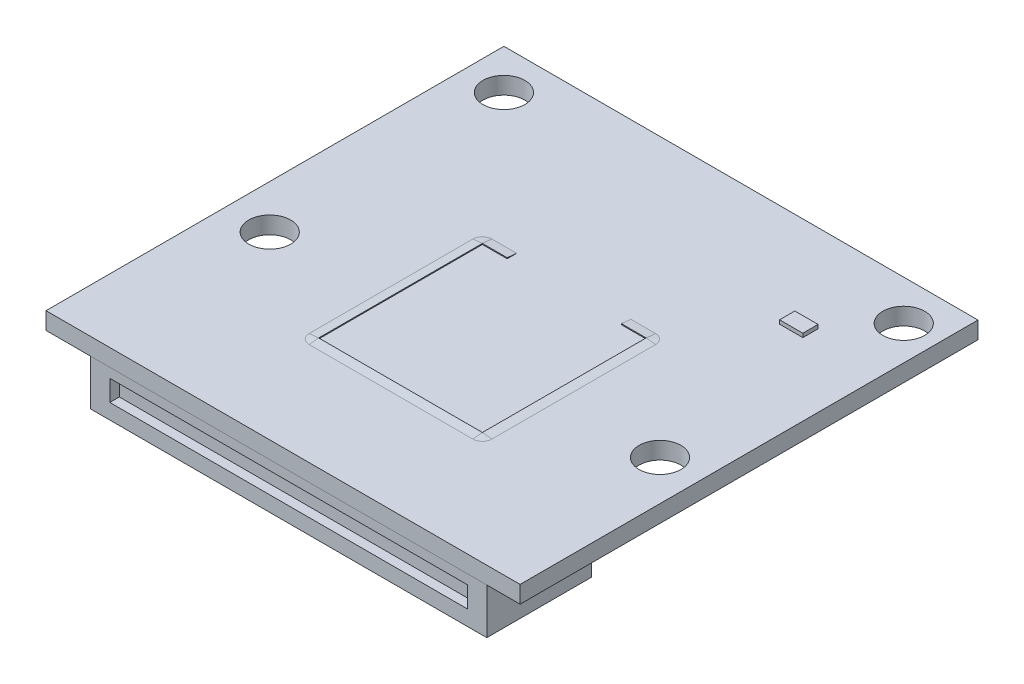
from build123d import *
from OCP.BRepFilletAPI import BRepFilletAPI_MakeChamfer

# Parameters (mm, degrees)
SKIZZE1_W               = 24.9
SKIZZE1_H               = 24.05
SKIZZE1_R               = 1.1
PCB_DEPTH               = 0.9
BOSS_EXTRUDE1_DEPTH     = 0.05
SKIZZE3_W               = 20.8
SKIZZE3_H               = 5.5
CONNECTOR_CLOSED_DEPTH  = 2.4
ESQUISSE1_W             = 1.22
ESQUISSE1_H             = 0.8
STATUS_LED_DEPTH        = 0.2
ESQUISSE3_W             = 18.8
ESQUISSE3_H             = 1.1
ENL_V_MAT_EXTRU_1_DEPTH = 0.5
FILLET1_R               = 0.5
CHAMFER1_SIZE           = 0.05
CHAMFER1_SIZE_2         = 0.5


with BuildPart() as part:
    # Skizze1 → PCB (new body)
    with BuildSketch(Plane(origin=(0, 0, 0), x_dir=(1, 0, 0), z_dir=(0, 1, 0))):
        with Locations((-0.3, 1.855)):
            Rectangle(SKIZZE1_W, SKIZZE1_H)
        with Locations(Location((-10.65, 11.78, 0), (0, 0, 270))):
            Circle(SKIZZE1_R, mode=Mode.SUBTRACT)
        with Locations(Location((10.35, 11.78, 0), (0, 0, 270))):
            Circle(SKIZZE1_R, mode=Mode.SUBTRACT)
        with Locations(Location((-10.45, -0.72, 0), (0, 0, 270))):
            Circle(SKIZZE1_R, mode=Mode.SUBTRACT)
        with Locations(Location((10.05, -0.72, 0), (0, 0, 270))):
            Circle(SKIZZE1_R, mode=Mode.SUBTRACT)
    extrude(amount=-PCB_DEPTH)

    # Sketch4 → Boss-Extrude1 (add)
    with BuildSketch(Plane(origin=(0, 0, 0), x_dir=(1, 0, 0), z_dir=(0, 1, 0))):
        Polygon((-4.3, 4.3), (-3, 4.3), (-3, 4.8), (-4.8, 4.8), (-4.8, -4.8), (4.8, -4.8), (4.8, 4.8), (3, 4.8), (3, 4.3), (4.3, 4.3), (4.3, -4.3), (-4.3, -4.3), align=None)
    extrude(amount=BOSS_EXTRUDE1_DEPTH)

    # Skizze3 → Connector_closed (add)
    with BuildSketch(Plane.XZ.offset(0.9)):
        with Locations((0, 7.42)):
            Rectangle(SKIZZE3_W, SKIZZE3_H)
    extrude(amount=CONNECTOR_CLOSED_DEPTH)

    # Esquisse1 → Status LED (add)
    with BuildSketch(Plane(origin=(0, 0, 0), x_dir=(1, 0, 0), z_dir=(0, 1, 0))):
        with Locations((7.74, 8.88)):
            Rectangle(ESQUISSE1_W, ESQUISSE1_H)
    extrude(amount=STATUS_LED_DEPTH)

    # Esquisse3 → Enlèv. mat.-Extru.1 (cut)
    with BuildSketch(Plane.XY.offset(10.17)):
        with Locations((0, -1.95)):
            Rectangle(ESQUISSE3_W, ESQUISSE3_H)
    extrude(amount=-ENL_V_MAT_EXTRU_1_DEPTH, mode=Mode.SUBTRACT)

    # Fillet1
    fillet1_edges = [part.edges().sort_by_distance(p)[0] for p in [
        (-4.8, 0.025, -4.8),
        (-4.8, 0.025, 4.8),
        (4.8, 0.025, 4.8),
        (4.8, 0.025, -4.8),
    ]]
    fillet(fillet1_edges, radius=FILLET1_R)

    # Chamfer1
    chamfer1_edges_1 = [part.edges().sort_by_distance(p)[0] for p in [
        (3.65, 0.05, -4.8),
    ]]
    chamfer1_side_1 = [part.faces().sort_by_distance(p)[0] for p in [
        (3.65, 0.049, -4.8),
    ]]
    chamfer1_edges_2 = [part.edges().sort_by_distance(p)[0] for p in [
        (4.8, 0.05, 0),
    ]]
    chamfer1_side_2 = [part.faces().sort_by_distance(p)[0] for p in [
        (4.8, 0.049, 0),
    ]]
    chamfer1_edges_3 = [part.edges().sort_by_distance(p)[0] for p in [
        (0, 0.05, 4.8),
    ]]
    chamfer1_side_3 = [part.faces().sort_by_distance(p)[0] for p in [
        (0, 0.049, 4.8),
    ]]
    chamfer1_edges_4 = [part.edges().sort_by_distance(p)[0] for p in [
        (-4.8, 0.05, 0),
    ]]
    chamfer1_side_4 = [part.faces().sort_by_distance(p)[0] for p in [
        (-4.8, 0.049, 0),
    ]]
    chamfer1_edges_5 = [part.edges().sort_by_distance(p)[0] for p in [
        (-3.65, 0.05, -4.8),
    ]]
    chamfer1_side_5 = [part.faces().sort_by_distance(p)[0] for p in [
        (-3.65, 0.049, -4.8),
    ]]
    chamfer1_edges_6 = [part.edges().sort_by_distance(p)[0] for p in [
        (4.653553391, 0.05, -4.653553391),
    ]]
    chamfer1_side_6 = [part.faces().sort_by_distance(p)[0] for p in [
        (4.653553391, 0.049, -4.653553391),
    ]]
    chamfer1_edges_7 = [part.edges().sort_by_distance(p)[0] for p in [
        (4.653553391, 0.05, 4.653553391),
    ]]
    chamfer1_side_7 = [part.faces().sort_by_distance(p)[0] for p in [
        (4.653553391, 0.049, 4.653553391),
    ]]
    chamfer1_edges_8 = [part.edges().sort_by_distance(p)[0] for p in [
        (-4.653553391, 0.05, 4.653553391),
    ]]
    chamfer1_side_8 = [part.faces().sort_by_distance(p)[0] for p in [
        (-4.653553391, 0.049, 4.653553391),
    ]]
    chamfer1_edges_9 = [part.edges().sort_by_distance(p)[0] for p in [
        (-4.653553391, 0.05, -4.653553391),
    ]]
    chamfer1_side_9 = [part.faces().sort_by_distance(p)[0] for p in [
        (-4.653553391, 0.049, -4.653553391),
    ]]
    chamfer1 = BRepFilletAPI_MakeChamfer(part.part.solid().wrapped)
    for e in chamfer1_edges_1:
        chamfer1.Add(CHAMFER1_SIZE - 0.0001, CHAMFER1_SIZE_2 - 0.0001, e.wrapped, chamfer1_side_1[0].wrapped)
    for e in chamfer1_edges_2:
        chamfer1.Add(CHAMFER1_SIZE - 0.0001, CHAMFER1_SIZE_2 - 0.0001, e.wrapped, chamfer1_side_2[0].wrapped)
    for e in chamfer1_edges_3:
        chamfer1.Add(CHAMFER1_SIZE - 0.0001, CHAMFER1_SIZE_2 - 0.0001, e.wrapped, chamfer1_side_3[0].wrapped)
    for e in chamfer1_edges_4:
        chamfer1.Add(CHAMFER1_SIZE - 0.0001, CHAMFER1_SIZE_2 - 0.0001, e.wrapped, chamfer1_side_4[0].wrapped)
    for e in chamfer1_edges_5:
        chamfer1.Add(CHAMFER1_SIZE - 0.0001, CHAMFER1_SIZE_2 - 0.0001, e.wrapped, chamfer1_side_5[0].wrapped)
    for e in chamfer1_edges_6:
        chamfer1.Add(CHAMFER1_SIZE - 0.0001, CHAMFER1_SIZE_2 - 0.0001, e.wrapped, chamfer1_side_6[0].wrapped)
    for e in chamfer1_edges_7:
        chamfer1.Add(CHAMFER1_SIZE - 0.0001, CHAMFER1_SIZE_2 - 0.0001, e.wrapped, chamfer1_side_7[0].wrapped)
    for e in chamfer1_edges_8:
        chamfer1.Add(CHAMFER1_SIZE - 0.0001, CHAMFER1_SIZE_2 - 0.0001, e.wrapped, chamfer1_side_8[0].wrapped)
    for e in chamfer1_edges_9:
        chamfer1.Add(CHAMFER1_SIZE - 0.0001, CHAMFER1_SIZE_2 - 0.0001, e.wrapped, chamfer1_side_9[0].wrapped)
    add(Compound.cast(chamfer1.Shape()), mode=Mode.REPLACE)  # a hair under: the kernel refuses the full size


solid = part.part
